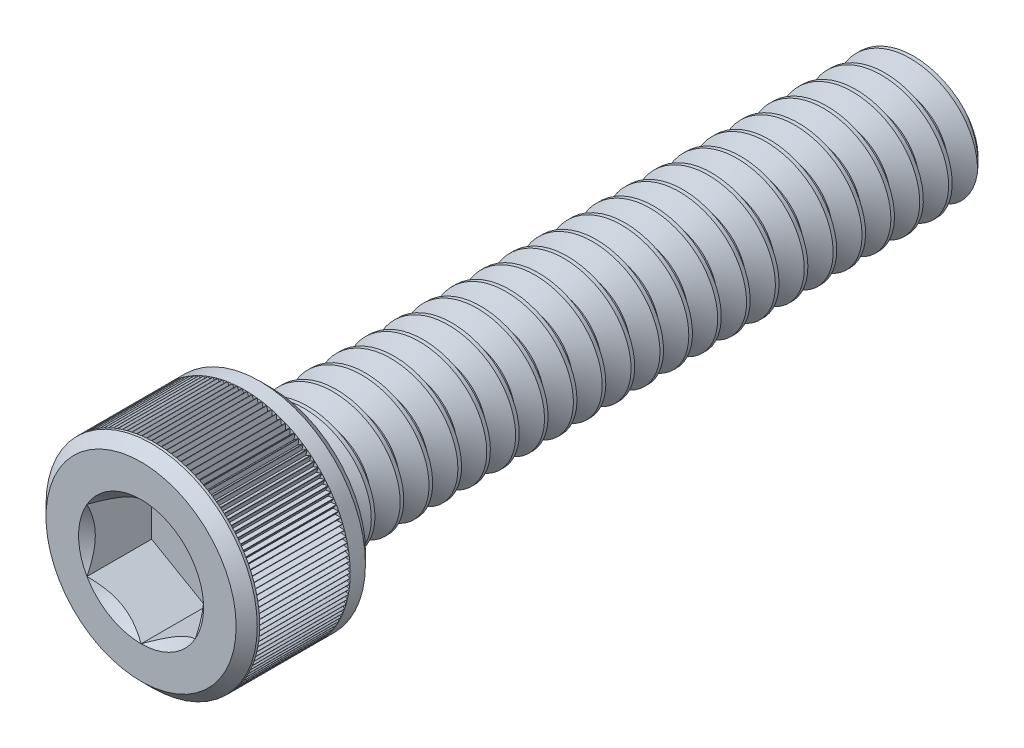
from build123d import *

# Parameters (mm, degrees)
CUT_EXTRUDE1_DEPTH = 1.4224
CUT_SWEEP1_PITCH   = 0.635
CUT_SWEEP1_FROM    = 0
CUT_EXTRUDE3_START = 1.13792
CUT_EXTRUDE3_DEPTH = 1.99136
CIRPATTERN1_COUNT  = 134


with BuildPart() as part:
    # Sketch2 → Revolve1 (revolve)
    with BuildSketch(Plane(origin=(0, 0, 0), x_dir=(0, 0, -1), z_dir=(1, 0, 0)), mode=Mode.PRIVATE) as revolve1_sk:
        Polygon((14.2875, 1.28016), (14.14526, 1.4224), (0, 1.4224), (0, 2.09169), (-0.23241, 2.3241), (-2.61239, 2.3241), (-2.8448, 2.09169), (-2.8448, 1.190625), (-1.4224, 1.190625), (-1.4224, 0), (14.2875, 0), align=None)
    revolve(revolve1_sk.sketch.rotate(Axis((0, 0, 1.4224), (0, 0, -1)), 90), axis=Axis((0, 0, 1.4224), (0, 0, -1)))

    # Sketch3 → Cut-Extrude1 (cut)
    with BuildSketch(Plane.XY.offset(2.8448)):
        Polygon((0, 1.374815329), (-1.190625, 0.687407664), (-1.190625, -0.687407664), (0, -1.374815329), (1.190625, -0.687407664), (1.190625, 0.687407664), align=None)
    extrude(amount=-CUT_EXTRUDE1_DEPTH, mode=Mode.SUBTRACT)

    # Cut-Extrude2 cone 1 section (through the dimple's axis) → Cut-Extrude2 (revolve, cut)
    with BuildSketch(Plane(origin=(0, 0, 2.8448), x_dir=(0, -1, 0), z_dir=(1, 0, 0))):
        Polygon((0, 0), (1.374815329, 0), (0, 1.374815329), align=None)
    revolve(axis=Axis((0, 0, 2.8448), (0, 0, -1)), mode=Mode.SUBTRACT)


with BuildPart() as body_2:
    # Split1: read off the stored shape, not the designer's step
    # Split1: the piece on the far side of the plane
    add(part.part)
    split(bisect_by=Plane.XY, keep=Keep.BOTTOM)

    # Cut-Sweep1: arcs per turn and ends read off the stored shape
    # Cut-Sweep1: the profile of Sketch7 screwed along a right-hand helix through 24.5 turns, 6 arcs to a turn; built about Z, then put on its axis
    cut_sweep1_z = Axis((0, 0, 0), (0, 0, 1))
    cut_sweep1_corners = [(1.456770383, 0, -1.21046875), (1.491140766, 0, -0.5953125), (1.009955401, 0, -0.873125), (1.009955401, 0, -0.9525)]
    with BuildLine(mode=Mode.PRIVATE) as cut_sweep1_profile:
        Line(cut_sweep1_corners[0], cut_sweep1_corners[1])
        Line(cut_sweep1_corners[1], cut_sweep1_corners[2])
        Line(cut_sweep1_corners[2], cut_sweep1_corners[3])
        Line(cut_sweep1_corners[3], cut_sweep1_corners[0])
    cut_sweep1_cap = Face(cut_sweep1_profile.wire())
    cut_sweep1_turn_angles = [0, 30, 60, 90, 120, 150, 180, 210, 240, 270, 300, 330, 360]
    cut_sweep1_turn_weights = [1, 0.8660254037844387, 1, 0.8660254037844387, 1, 0.8660254037844387, 1, 0.8660254037844387, 1, 0.8660254037844387, 1, 0.8660254037844387, 1]
    cut_sweep1_turn_rails = [Edge.make_bspline([Vector(p[0], p[1], 0).rotate(cut_sweep1_z, cut_sweep1_turn_angles[k]) / cut_sweep1_turn_weights[k] + Vector(0, 0, p[2] + CUT_SWEEP1_PITCH * cut_sweep1_turn_angles[k] / 360) for k in range(13)], [0, 0, 0, 1, 1, 2, 2, 3, 3, 4, 4, 5, 5, 6, 6, 6], 2, cut_sweep1_turn_weights) for p in cut_sweep1_corners]
    cut_sweep1_turn_sides = [Face.make_surface_from_curves(cut_sweep1_turn_rails[p[0]], cut_sweep1_turn_rails[p[1]]) for p in [(0, 1), (1, 2), (2, 3), (3, 0)]]
    cut_sweep1_last_angles = [8640, 8670, 8700, 8730, 8760, 8790, 8820]
    cut_sweep1_last_weights = [1, 0.8660254037844387, 1, 0.8660254037844387, 1, 0.8660254037844387, 1]
    cut_sweep1_last_rails = [Edge.make_bspline([Vector(p[0], p[1], 0).rotate(cut_sweep1_z, cut_sweep1_last_angles[k]) / cut_sweep1_last_weights[k] + Vector(0, 0, p[2] + CUT_SWEEP1_PITCH * cut_sweep1_last_angles[k] / 360) for k in range(7)], [0, 0, 0, 1, 1, 2, 2, 3, 3, 3], 2, cut_sweep1_last_weights) for p in cut_sweep1_corners]
    cut_sweep1_last_sides = [Face.make_surface_from_curves(cut_sweep1_last_rails[p[0]], cut_sweep1_last_rails[p[1]]) for p in [(0, 1), (1, 2), (2, 3), (3, 0)]]
    cut_sweep1 = Plane(origin=(0, 0, 0), x_dir=(0, 1, 0), z_dir=(0, 0, -1)) * split(Solid(Shell([*[p.moved(Location((0, 0, CUT_SWEEP1_PITCH * i))) for i in range(24) for p in cut_sweep1_turn_sides], *cut_sweep1_last_sides, cut_sweep1_cap, cut_sweep1_cap.rotate(cut_sweep1_z, 8820).moved(Location((0, 0, CUT_SWEEP1_PITCH * 8820 / 360)))])), bisect_by=Plane.XY.offset(CUT_SWEEP1_FROM), keep=Keep.TOP, mode=Mode.PRIVATE)
    add(cut_sweep1, mode=Mode.SUBTRACT)


with BuildPart() as part_1:
    add(part.part)

    # Split1
    split(bisect_by=Plane.XY, keep=Keep.TOP)

    # Combine1: union body 2
    add(body_2.part)

    # Sketch8 → Cut-Extrude3 (cut)
    with BuildSketch(Plane.XY.offset(1.4224).offset(CUT_EXTRUDE3_START)):
        with BuildLine():
            Line((-0.050699974, 2.323546927), (0, 2.207895))
            Line((0, 2.207895), (0.050699974, 2.323546927))
            ThreePointArc((0.050699974, 2.323546927), (0, 2.3241), (-0.050699974, 2.323546927))
        make_face()
    cut_extrude3 = extrude(amount=-CUT_EXTRUDE3_DEPTH, mode=Mode.SUBTRACT)

    # CirPattern1: Cut-Extrude3 ×134 about axis
    cirpattern1_axis = Axis((0, 0, 0), (0, 0, 1))
    for i in range(1, CIRPATTERN1_COUNT):
        add(cut_extrude3.rotate(cirpattern1_axis, i * 360 / CIRPATTERN1_COUNT), mode=Mode.SUBTRACT)


solid = part_1.part
